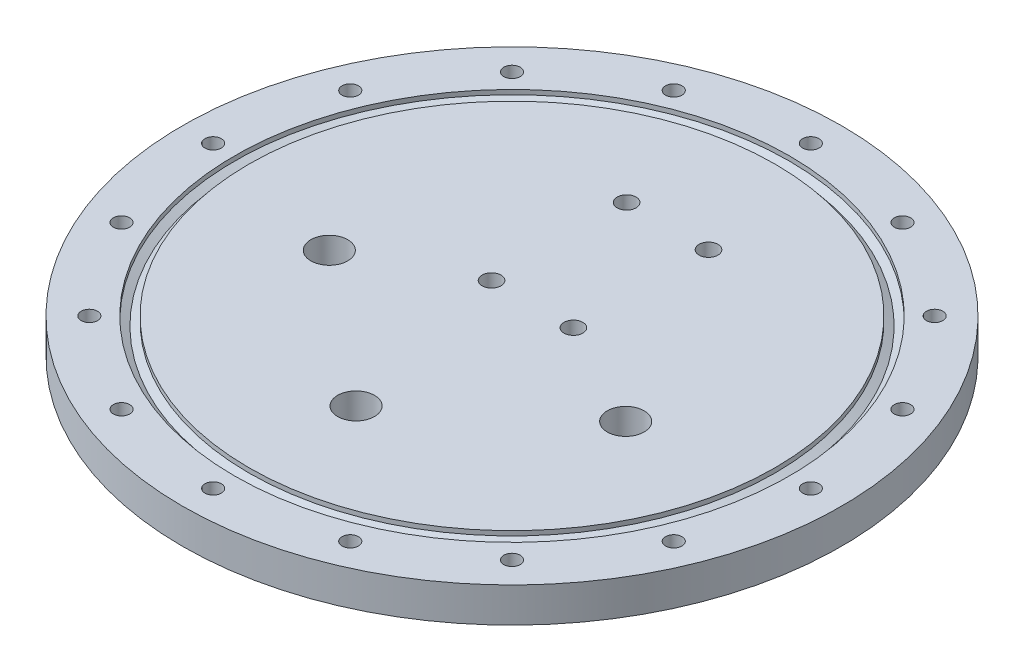
from build123d import *

# Parameters (mm, degrees)
SKETCH1_R           = 80.5
BOSS_EXTRUDE1_DEPTH = 8.5
CUT_EXTRUDE1_REACH  = 116.161
SKETCH2_R           = 2
CUT_EXTRUDE2_REACH  = 116.161
SKETCH5_R           = 4.5
SKETCH6_R           = 2.3
CUT_EXTRUDE3_DEPTH  = 5


with BuildPart() as part:
    # Sketch1 → Boss-Extrude1 (new body)
    with BuildSketch(Plane(origin=(0, 0, 0), x_dir=(1, 0, 0), z_dir=(0, 1, 0))):
        Circle(SKETCH1_R)
    extrude(amount=BOSS_EXTRUDE1_DEPTH)

    # Sketch2 → Cut-Extrude1 (cut, up to next)
    with BuildSketch(Plane(origin=(0, 8.5, 0), x_dir=(1, 0, 0), z_dir=(0, 1, 0)), mode=Mode.PRIVATE) as cut_extrude1_sk1:
        with Locations((0, 73)):
            Circle(SKETCH2_R)
    cut_extrude1_tool1 = extrude(cut_extrude1_sk1.sketch, amount=-CUT_EXTRUDE1_REACH, mode=Mode.PRIVATE) & part.part
    # Sketch2 → Cut-Extrude1 (cut, up to next)
    with BuildSketch(Plane(origin=(0, 8.5, 0), x_dir=(1, 0, 0), z_dir=(0, 1, 0)), mode=Mode.PRIVATE) as cut_extrude1_sk2:
        with Locations((27.935890563, 67.443205873)):
            Circle(SKETCH2_R)
    cut_extrude1_tool2 = extrude(cut_extrude1_sk2.sketch, amount=-CUT_EXTRUDE1_REACH, mode=Mode.PRIVATE) & part.part
    # Sketch2 → Cut-Extrude1 (cut, up to next)
    with BuildSketch(Plane(origin=(0, 8.5, 0), x_dir=(1, 0, 0), z_dir=(0, 1, 0)), mode=Mode.PRIVATE) as cut_extrude1_sk3:
        with Locations((51.618795027, 51.618795027)):
            Circle(SKETCH2_R)
    cut_extrude1_tool3 = extrude(cut_extrude1_sk3.sketch, amount=-CUT_EXTRUDE1_REACH, mode=Mode.PRIVATE) & part.part
    # Sketch2 → Cut-Extrude1 (cut, up to next)
    with BuildSketch(Plane(origin=(0, 8.5, 0), x_dir=(1, 0, 0), z_dir=(0, 1, 0)), mode=Mode.PRIVATE) as cut_extrude1_sk4:
        with Locations((67.443205873, 27.935890563)):
            Circle(SKETCH2_R)
    cut_extrude1_tool4 = extrude(cut_extrude1_sk4.sketch, amount=-CUT_EXTRUDE1_REACH, mode=Mode.PRIVATE) & part.part
    # Sketch2 → Cut-Extrude1 (cut, up to next)
    with BuildSketch(Plane(origin=(0, 8.5, 0), x_dir=(1, 0, 0), z_dir=(0, 1, 0)), mode=Mode.PRIVATE) as cut_extrude1_sk5:
        with Locations((73, 0)):
            Circle(SKETCH2_R)
    cut_extrude1_tool5 = extrude(cut_extrude1_sk5.sketch, amount=-CUT_EXTRUDE1_REACH, mode=Mode.PRIVATE) & part.part
    # Sketch2 → Cut-Extrude1 (cut, up to next)
    with BuildSketch(Plane(origin=(0, 8.5, 0), x_dir=(1, 0, 0), z_dir=(0, 1, 0)), mode=Mode.PRIVATE) as cut_extrude1_sk6:
        with Locations((67.443205873, -27.935890563)):
            Circle(SKETCH2_R)
    cut_extrude1_tool6 = extrude(cut_extrude1_sk6.sketch, amount=-CUT_EXTRUDE1_REACH, mode=Mode.PRIVATE) & part.part
    # Sketch2 → Cut-Extrude1 (cut, up to next)
    with BuildSketch(Plane(origin=(0, 8.5, 0), x_dir=(1, 0, 0), z_dir=(0, 1, 0)), mode=Mode.PRIVATE) as cut_extrude1_sk7:
        with Locations((51.618795027, -51.618795027)):
            Circle(SKETCH2_R)
    cut_extrude1_tool7 = extrude(cut_extrude1_sk7.sketch, amount=-CUT_EXTRUDE1_REACH, mode=Mode.PRIVATE) & part.part
    # Sketch2 → Cut-Extrude1 (cut, up to next)
    with BuildSketch(Plane(origin=(0, 8.5, 0), x_dir=(1, 0, 0), z_dir=(0, 1, 0)), mode=Mode.PRIVATE) as cut_extrude1_sk8:
        with Locations((27.935890563, -67.443205873)):
            Circle(SKETCH2_R)
    cut_extrude1_tool8 = extrude(cut_extrude1_sk8.sketch, amount=-CUT_EXTRUDE1_REACH, mode=Mode.PRIVATE) & part.part
    # Sketch2 → Cut-Extrude1 (cut, up to next)
    with BuildSketch(Plane(origin=(0, 8.5, 0), x_dir=(1, 0, 0), z_dir=(0, 1, 0)), mode=Mode.PRIVATE) as cut_extrude1_sk9:
        with Locations((0, -73)):
            Circle(SKETCH2_R)
    cut_extrude1_tool9 = extrude(cut_extrude1_sk9.sketch, amount=-CUT_EXTRUDE1_REACH, mode=Mode.PRIVATE) & part.part
    # Sketch2 → Cut-Extrude1 (cut, up to next)
    with BuildSketch(Plane(origin=(0, 8.5, 0), x_dir=(1, 0, 0), z_dir=(0, 1, 0)), mode=Mode.PRIVATE) as cut_extrude1_sk10:
        with Locations((-27.935890563, -67.443205873)):
            Circle(SKETCH2_R)
    cut_extrude1_tool10 = extrude(cut_extrude1_sk10.sketch, amount=-CUT_EXTRUDE1_REACH, mode=Mode.PRIVATE) & part.part
    # Sketch2 → Cut-Extrude1 (cut, up to next)
    with BuildSketch(Plane(origin=(0, 8.5, 0), x_dir=(1, 0, 0), z_dir=(0, 1, 0)), mode=Mode.PRIVATE) as cut_extrude1_sk11:
        with Locations((-51.618795027, -51.618795027)):
            Circle(SKETCH2_R)
    cut_extrude1_tool11 = extrude(cut_extrude1_sk11.sketch, amount=-CUT_EXTRUDE1_REACH, mode=Mode.PRIVATE) & part.part
    # Sketch2 → Cut-Extrude1 (cut, up to next)
    with BuildSketch(Plane(origin=(0, 8.5, 0), x_dir=(1, 0, 0), z_dir=(0, 1, 0)), mode=Mode.PRIVATE) as cut_extrude1_sk12:
        with Locations((-67.443205873, -27.935890563)):
            Circle(SKETCH2_R)
    cut_extrude1_tool12 = extrude(cut_extrude1_sk12.sketch, amount=-CUT_EXTRUDE1_REACH, mode=Mode.PRIVATE) & part.part
    # Sketch2 → Cut-Extrude1 (cut, up to next)
    with BuildSketch(Plane(origin=(0, 8.5, 0), x_dir=(1, 0, 0), z_dir=(0, 1, 0)), mode=Mode.PRIVATE) as cut_extrude1_sk13:
        with Locations((-73, 0)):
            Circle(SKETCH2_R)
    cut_extrude1_tool13 = extrude(cut_extrude1_sk13.sketch, amount=-CUT_EXTRUDE1_REACH, mode=Mode.PRIVATE) & part.part
    # Sketch2 → Cut-Extrude1 (cut, up to next)
    with BuildSketch(Plane(origin=(0, 8.5, 0), x_dir=(1, 0, 0), z_dir=(0, 1, 0)), mode=Mode.PRIVATE) as cut_extrude1_sk14:
        with Locations((-67.443205873, 27.935890563)):
            Circle(SKETCH2_R)
    cut_extrude1_tool14 = extrude(cut_extrude1_sk14.sketch, amount=-CUT_EXTRUDE1_REACH, mode=Mode.PRIVATE) & part.part
    # Sketch2 → Cut-Extrude1 (cut, up to next)
    with BuildSketch(Plane(origin=(0, 8.5, 0), x_dir=(1, 0, 0), z_dir=(0, 1, 0)), mode=Mode.PRIVATE) as cut_extrude1_sk15:
        with Locations((-51.618795027, 51.618795027)):
            Circle(SKETCH2_R)
    cut_extrude1_tool15 = extrude(cut_extrude1_sk15.sketch, amount=-CUT_EXTRUDE1_REACH, mode=Mode.PRIVATE) & part.part
    # Sketch2 → Cut-Extrude1 (cut, up to next)
    with BuildSketch(Plane(origin=(0, 8.5, 0), x_dir=(1, 0, 0), z_dir=(0, 1, 0)), mode=Mode.PRIVATE) as cut_extrude1_sk16:
        with Locations((-27.935890563, 67.443205873)):
            Circle(SKETCH2_R)
    cut_extrude1_tool16 = extrude(cut_extrude1_sk16.sketch, amount=-CUT_EXTRUDE1_REACH, mode=Mode.PRIVATE) & part.part
    add(cut_extrude1_tool1.solids().sort_by_distance((0, 8.5, -73))[0], mode=Mode.SUBTRACT)
    add(cut_extrude1_tool2.solids().sort_by_distance((27.935891, 8.5, -67.443206))[0], mode=Mode.SUBTRACT)
    add(cut_extrude1_tool3.solids().sort_by_distance((51.618795, 8.5, -51.618795))[0], mode=Mode.SUBTRACT)
    add(cut_extrude1_tool4.solids().sort_by_distance((67.443206, 8.5, -27.935891))[0], mode=Mode.SUBTRACT)
    add(cut_extrude1_tool5.solids().sort_by_distance((73, 8.5, 0))[0], mode=Mode.SUBTRACT)
    add(cut_extrude1_tool6.solids().sort_by_distance((67.443206, 8.5, 27.935891))[0], mode=Mode.SUBTRACT)
    add(cut_extrude1_tool7.solids().sort_by_distance((51.618795, 8.5, 51.618795))[0], mode=Mode.SUBTRACT)
    add(cut_extrude1_tool8.solids().sort_by_distance((27.935891, 8.5, 67.443206))[0], mode=Mode.SUBTRACT)
    add(cut_extrude1_tool9.solids().sort_by_distance((0, 8.5, 73))[0], mode=Mode.SUBTRACT)
    add(cut_extrude1_tool10.solids().sort_by_distance((-27.935891, 8.5, 67.443206))[0], mode=Mode.SUBTRACT)
    add(cut_extrude1_tool11.solids().sort_by_distance((-51.618795, 8.5, 51.618795))[0], mode=Mode.SUBTRACT)
    add(cut_extrude1_tool12.solids().sort_by_distance((-67.443206, 8.5, 27.935891))[0], mode=Mode.SUBTRACT)
    add(cut_extrude1_tool13.solids().sort_by_distance((-73, 8.5, 0))[0], mode=Mode.SUBTRACT)
    add(cut_extrude1_tool14.solids().sort_by_distance((-67.443206, 8.5, -27.935891))[0], mode=Mode.SUBTRACT)
    add(cut_extrude1_tool15.solids().sort_by_distance((-51.618795, 8.5, -51.618795))[0], mode=Mode.SUBTRACT)
    add(cut_extrude1_tool16.solids().sort_by_distance((-27.935891, 8.5, -67.443206))[0], mode=Mode.SUBTRACT)

    # Sketch5 → Cut-Extrude2 (cut, up to next)
    with BuildSketch(Plane.XZ, mode=Mode.PRIVATE) as cut_extrude2_sk1:
        with Locations((36.2, 8.43)):
            Circle(SKETCH5_R)
    cut_extrude2_tool1 = extrude(cut_extrude2_sk1.sketch, amount=-CUT_EXTRUDE2_REACH, mode=Mode.PRIVATE) & part.part
    # Sketch5 → Cut-Extrude2 (cut, up to next)
    with BuildSketch(Plane.XZ, mode=Mode.PRIVATE) as cut_extrude2_sk2:
        with Locations((-36.2, 8.43)):
            Circle(SKETCH5_R)
    cut_extrude2_tool2 = extrude(cut_extrude2_sk2.sketch, amount=-CUT_EXTRUDE2_REACH, mode=Mode.PRIVATE) & part.part
    # Sketch5 → Cut-Extrude2 (cut, up to next)
    with BuildSketch(Plane.XZ, mode=Mode.PRIVATE) as cut_extrude2_sk3:
        with Locations((0, 38.091601132)):
            Circle(SKETCH5_R)
    cut_extrude2_tool3 = extrude(cut_extrude2_sk3.sketch, amount=-CUT_EXTRUDE2_REACH, mode=Mode.PRIVATE) & part.part
    add(cut_extrude2_tool1.solids().sort_by_distance((36.2, 0, 8.43))[0], mode=Mode.SUBTRACT)
    add(cut_extrude2_tool2.solids().sort_by_distance((-36.2, 0, 8.43))[0], mode=Mode.SUBTRACT)
    add(cut_extrude2_tool3.solids().sort_by_distance((0, 0, 38.091601))[0], mode=Mode.SUBTRACT)

    # Sketch4 → Cut-Revolve1 (revolve, cut)
    with BuildSketch(Plane.XY):
        Polygon((67.75, 7.380362971), (67.75, 8.5), (64.25, 8.5), (64.25, 7.380362971), (66, 6.37), align=None)
    revolve(axis=Axis((0, 0, 0), (0, 1, 0)), mode=Mode.SUBTRACT)

    # Sketch6 → Cut-Extrude3 (cut)
    with BuildSketch(Plane(origin=(0, 8.5, 0), x_dir=(1, 0, 0), z_dir=(0, 1, 0))):
        with Locations((-10, 5)):
            Circle(SKETCH6_R)
        with Locations((10, 5)):
            Circle(SKETCH6_R)
        with Locations((-10, 38)):
            Circle(SKETCH6_R)
        with Locations((10, 38)):
            Circle(SKETCH6_R)
    extrude(amount=-CUT_EXTRUDE3_DEPTH, mode=Mode.SUBTRACT)


solid = part.part
